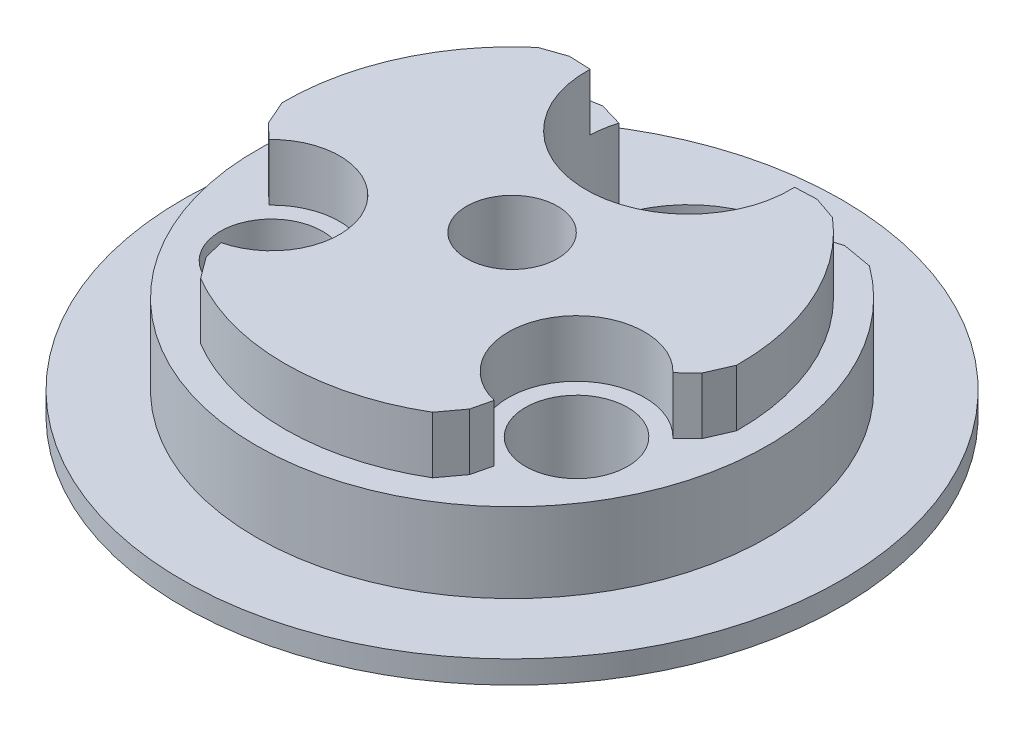
from build123d import *
from build123d.topology import SkipClean

# Parameters (mm, degrees)
BOSS_EXTRUDE1_DEPTH      = 7
BOSS_EXTRUDE3_DEPTH      = 5
BOSS_EXTRUDE3_DEPTH_BACK = 7
BOSS_EXTRUDE5_DEPTH      = 7
CUT_EXTRUDE1_START       = -5
CUT_EXTRUDE1_DEPTH       = 5
SKETCH5_R                = 4
CUT_EXTRUDE2_DEPTH       = 35.007352146
BOSS_EXTRUDE7_START      = 2
SKETCH6_R                = 29
SKETCH6_R_2              = 4.5
SKETCH6_R_3              = 4
BOSS_EXTRUDE7_DEPTH      = 2
CUT_EXTRUDE6_START       = -12
CUT_EXTRUDE6_DEPTH       = 12
BOSS_EXTRUDE8_DEPTH      = 7


with BuildPart() as part:
    # Sketch1 → Boss-Extrude1 (new body)
    with BuildSketch(Plane(origin=(0, 0, 0), x_dir=(1, 0, 0), z_dir=(0, 1, 0))):
        with BuildLine():
            ThreePointArc((21.960068583, -4.899529347), (22.364609801, -2.464594985), (22.5, 0))
            ThreePointArc((22.5, 0), (18.136022741, 13.316706768), (6.73691741, 21.467741935))
            ThreePointArc((6.73691741, 21.467741935), (8.415231925, 18.691217895), (9, 15.5))
            ThreePointArc((9, 15.5), (-3.191217895, 7.084768075), (-6.73691741, 21.467741935))
            ThreePointArc((-6.73691741, 21.467741935), (-19.485571585, 11.25), (-21.960068583, -4.899529347))
            ThreePointArc((-21.960068583, -4.899529347), (-11.979453563, 1.133413573), (-4.423393759, -7.75))
            ThreePointArc((-4.423393759, -7.75), (-7.731198081, -14.721291729), (-15.223151173, -16.568212588))
            ThreePointArc((-15.223151173, -16.568212588), (0, -22.5), (15.223151173, -16.568212588))
            ThreePointArc((15.223151173, -16.568212588), (5.629165125, -3.25), (21.960068583, -4.899529347))
        make_face()
    extrude(amount=BOSS_EXTRUDE1_DEPTH)

    # Sketch2 → Boss-Extrude3 (add, two sides: drawn at the far end of the back side and taken through both)
    with BuildSketch(Plane(origin=(0, 7, 0), x_dir=(1, 0, 0), z_dir=(0, 1, 0)).offset(-BOSS_EXTRUDE3_DEPTH_BACK)):
        with BuildLine():
            ThreePointArc((-11.306354333, -16.497465008), (0, -20), (11.306354333, -16.497465008))
            Line((11.306354333, -16.497465008), (12.364874046, -12.123732504))
            ThreePointArc((12.364874046, -12.123732504), (9.526279442, -5.5), (16.68189736, -4.646428786))
            Line((16.68189736, -4.646428786), (19.940400962, -1.542857572))
            ThreePointArc((19.940400962, -1.542857572), (17.320508076, 10), (8.634046629, 18.040322581))
            ThreePointArc((8.634046629, 18.040322581), (0, 6.5), (-8.634046629, 18.040322581))
            ThreePointArc((-8.634046629, 18.040322581), (-17.320508076, 10), (-19.940400962, -1.542857572))
            Line((-19.940400962, -1.542857572), (-16.68189736, -4.646428786))
            ThreePointArc((-16.68189736, -4.646428786), (-9.526279442, -5.5), (-12.364874046, -12.123732504))
            Line((-12.364874046, -12.123732504), (-11.306354333, -16.497465008))
        make_face()
    extrude(amount=BOSS_EXTRUDE3_DEPTH + BOSS_EXTRUDE3_DEPTH_BACK)

    # Sketch3 → Boss-Extrude5 (add)
    with SkipClean():  # the faces are left unmerged after this step: merging them gives an invalid solid
        with BuildSketch(Plane.XZ):
            with BuildLine():
                ThreePointArc((-11.306354333, 16.497465008), (-13.260856767, 16.748532198), (-15.223151173, 16.568212588))
                ThreePointArc((-15.223151173, 16.568212588), (-19.485571585, 11.25), (-21.960068583, 4.899529347))
                ThreePointArc((-21.960068583, 4.899529347), (-21.135082743, 3.109972737), (-19.940400962, 1.542857572))
                Line((-19.940400962, 1.542857572), (-16.68189736, 4.646428786))
                ThreePointArc((-16.68189736, 4.646428786), (-17.320508076, 10), (-12.364874046, 12.123732504))
                Line((-12.364874046, 12.123732504), (-11.306354333, 16.497465008))
            make_face()
            with BuildLine():
                ThreePointArc((-19.940400962, 1.542857572), (-5.629165125, 3.25), (-11.306354333, 16.497465008))
                Line((-11.306354333, 16.497465008), (-12.364874046, 12.123732504))
                ThreePointArc((-12.364874046, 12.123732504), (-9.886916789, 10.532684072), (-8.923393759, 7.75))
                ThreePointArc((-8.923393759, 7.75), (-11.7520569, 3.571886418), (-16.68189736, 4.646428786))
                Line((-16.68189736, 4.646428786), (-19.940400962, 1.542857572))
            make_face()
            with BuildLine():
                Line((16.68189736, 4.646428786), (19.940400962, 1.542857572))
                ThreePointArc((19.940400962, 1.542857572), (21.135082743, 3.109972737), (21.960068583, 4.899529347))
                ThreePointArc((21.960068583, 4.899529347), (19.485571585, 11.25), (15.223151173, 16.568212588))
                ThreePointArc((15.223151173, 16.568212588), (13.260856767, 16.748532198), (11.306354333, 16.497465008))
                Line((11.306354333, 16.497465008), (12.364874046, 12.123732504))
                ThreePointArc((12.364874046, 12.123732504), (16.206077831, 11.286476969), (17.923393759, 7.75))
                ThreePointArc((17.923393759, 7.75), (17.601507341, 6.078663141), (16.68189736, 4.646428786))
            make_face()
            with BuildLine():
                ThreePointArc((11.306354333, 16.497465008), (5.629165125, 3.25), (19.940400962, 1.542857572))
                Line((19.940400962, 1.542857572), (16.68189736, 4.646428786))
                ThreePointArc((16.68189736, 4.646428786), (9.526279442, 5.5), (12.364874046, 12.123732504))
                Line((12.364874046, 12.123732504), (11.306354333, 16.497465008))
            make_face()
        extrude(amount=-BOSS_EXTRUDE5_DEPTH)

    # Sketch4 → Cut-Extrude1 (cut)
    with SkipClean():  # the faces are left unmerged after this step: merging them gives an invalid solid
        with BuildSketch(Plane(origin=(0, 12, 0), x_dir=(1, 0, 0), z_dir=(0, 1, 0)).offset(CUT_EXTRUDE1_START)):
            with BuildLine():
                ThreePointArc((-17.768065227, -3.611905048), (-18.619546181, -10.75), (-12.012034142, -13.581643339))
                Line((-12.012034142, -13.581643339), (-12.364874046, -12.123732504))
                ThreePointArc((-12.364874046, -12.123732504), (-9.526279442, -5.5), (-16.68189736, -4.646428786))
                Line((-16.68189736, -4.646428786), (-17.768065227, -3.611905048))
            make_face()
            with BuildLine():
                Line((-12.364874046, -12.123732504), (-12.012034142, -13.581643339))
                ThreePointArc((-12.012034142, -13.581643339), (-8.708091133, -11.46024543), (-7.423393759, -7.75))
                ThreePointArc((-7.423393759, -7.75), (-11.194944613, -2.179181891), (-17.768065227, -3.611905048))
                Line((-17.768065227, -3.611905048), (-16.68189736, -4.646428786))
                ThreePointArc((-16.68189736, -4.646428786), (-9.526279442, -5.5), (-12.364874046, -12.123732504))
            make_face()
            with BuildLine():
                ThreePointArc((12.364874046, -12.123732504), (9.526279442, -5.5), (16.68189736, -4.646428786))
                Line((16.68189736, -4.646428786), (17.768065227, -3.611905048))
                ThreePointArc((17.768065227, -3.611905048), (8.227241336, -4.75), (12.012034142, -13.581643339))
                Line((12.012034142, -13.581643339), (12.364874046, -12.123732504))
            make_face()
            with BuildLine():
                Line((17.768065227, -3.611905048), (16.68189736, -4.646428786))
                ThreePointArc((16.68189736, -4.646428786), (9.526279442, -5.5), (12.364874046, -12.123732504))
                Line((12.364874046, -12.123732504), (12.012034142, -13.581643339))
                ThreePointArc((12.012034142, -13.581643339), (17.133639188, -12.465302626), (19.423393759, -7.75))
                ThreePointArc((19.423393759, -7.75), (18.994211868, -5.521550855), (17.768065227, -3.611905048))
            make_face()
        extrude(amount=CUT_EXTRUDE1_DEPTH, mode=Mode.SUBTRACT)

    # Sketch5 → Cut-Extrude2 (cut, through all)
    with SkipClean():  # the faces are left unmerged after this step: merging them gives an invalid solid
        with BuildSketch(Plane(origin=(0, 12, 0), x_dir=(1, 0, 0), z_dir=(0, 1, 0))):
            with Locations(Location((0, 0, 0), (0, 0, 270))):
                Circle(SKETCH5_R)
        extrude(amount=-CUT_EXTRUDE2_DEPTH, mode=Mode.SUBTRACT)

    # Sketch6 → Boss-Extrude7 (add)
    # profile 1 of 2: a face of its own
    with SkipClean():  # the faces are left unmerged after this step: merging them gives an invalid solid
        with BuildSketch(Plane.XZ.offset(BOSS_EXTRUDE7_START)):
            with Locations(Location((0, 0, 0), (0, 0, 270))):
                Circle(SKETCH6_R)
            with BuildLine():
                ThreePointArc((6.73691741, -21.467741935), (0, -24.5), (-6.73691741, -21.467741935))
                ThreePointArc((-6.73691741, -21.467741935), (0, 22.5), (6.73691741, -21.467741935))
            make_face(mode=Mode.SUBTRACT)
        # profile 2 of 2: a face of its own
        with BuildSketch(Plane.XZ.offset(BOSS_EXTRUDE7_START)):
            with BuildLine():
                ThreePointArc((6.73691741, -21.467741935), (0, 22.5), (-6.73691741, -21.467741935))
                ThreePointArc((-6.73691741, -21.467741935), (0, -6.5), (6.73691741, -21.467741935))
            make_face()
            with Locations(Location((-13.423393759, 7.75, 0), (0, 0, 270))):
                Circle(SKETCH6_R_2, mode=Mode.SUBTRACT)
            with Locations(Location((13.423393759, 7.75, 0), (0, 0, 270))):
                Circle(SKETCH6_R_2, mode=Mode.SUBTRACT)
            with Locations(Location((0, 0, 0), (0, 0, 90))):
                Circle(SKETCH6_R_3, mode=Mode.SUBTRACT)
        extrude(amount=-BOSS_EXTRUDE7_DEPTH)

    # Sketch7 → Cut-Extrude6 (cut)
    with SkipClean():  # the faces are left unmerged after this step: merging them gives an invalid solid
        with BuildSketch(Plane(origin=(0, 12, 0), x_dir=(1, 0, 0), z_dir=(0, 1, 0)).offset(CUT_EXTRUDE6_START)):
            with BuildLine():
                ThreePointArc((8.634046629, 18.040322581), (8.638200135, 18.038334137), (8.642353183, 18.036344737))
                Line((8.642353183, 18.036344737), (12.012034142, 19.025273606))
                ThreePointArc((12.012034142, 19.025273606), (9.453687585, 20.417585338), (6.73691741, 21.467741935))
                ThreePointArc((6.73691741, 21.467741935), (7.874225977, 19.858504935), (8.634046629, 18.040322581))
            make_face()
            with BuildLine():
                ThreePointArc((8.634046629, 18.040322581), (8.634914915, 18.037369585), (8.635782192, 18.034416292))
                Line((8.635782192, 18.034416292), (8.642353183, 18.036344737))
                ThreePointArc((8.642353183, 18.036344737), (8.638200135, 18.038334137), (8.634046629, 18.040322581))
            make_face()
            with BuildLine():
                Line((8.642353183, 18.036344737), (8.635782192, 18.034416292))
                ThreePointArc((8.635782192, 18.034416292), (8.880475096, 16.961903579), (8.992491714, 15.8675497))
                Line((8.992491714, 15.8675497), (12.012034142, 15.990967319))
                ThreePointArc((12.012034142, 15.990967319), (10.377707894, 17.09687629), (8.642353183, 18.036344737))
            make_face()
            with BuildLine():
                ThreePointArc((-6.73691741, 21.467741935), (-9.453687585, 20.417585338), (-12.012034142, 19.025273606))
                Line((-12.012034142, 19.025273606), (-8.642353183, 18.036344737))
                ThreePointArc((-8.642353183, 18.036344737), (-8.638200135, 18.038334137), (-8.634046629, 18.040322581))
                ThreePointArc((-8.634046629, 18.040322581), (-7.874225977, 19.858504935), (-6.73691741, 21.467741935))
            make_face()
            with BuildLine():
                Line((-12.012034142, 15.990967319), (-8.992491714, 15.8675497))
                ThreePointArc((-8.992491714, 15.8675497), (-8.880475096, 16.961903579), (-8.635782192, 18.034416292))
                Line((-8.635782192, 18.034416292), (-8.642353183, 18.036344737))
                ThreePointArc((-8.642353183, 18.036344737), (-10.377707894, 17.09687629), (-12.012034142, 15.990967319))
            make_face()
            with BuildLine():
                Line((-8.642353183, 18.036344737), (-8.635782192, 18.034416292))
                ThreePointArc((-8.635782192, 18.034416292), (-8.634914915, 18.037369585), (-8.634046629, 18.040322581))
                ThreePointArc((-8.634046629, 18.040322581), (-8.638200135, 18.038334137), (-8.642353183, 18.036344737))
            make_face()
        extrude(amount=CUT_EXTRUDE6_DEPTH, mode=Mode.SUBTRACT)

    # Sketch8 → Boss-Extrude8 (add)
    with SkipClean():  # the faces are left unmerged after this step: merging them gives an invalid solid
        with BuildSketch(Plane(origin=(0, 0, 0), x_dir=(1, 0, 0), z_dir=(0, 1, 0))):
            with BuildLine():
                Line((-12.012034142, 15.990967319), (-8.992491714, 15.8675497))
                ThreePointArc((-8.992491714, 15.8675497), (-8.879974605, 16.96494062), (-8.634046629, 18.040322581))
                ThreePointArc((-8.634046629, 18.040322581), (-10.37377111, 17.099265275), (-12.012034142, 15.990967319))
            make_face()
            with BuildLine():
                Line((8.992491714, 15.8675497), (12.012034142, 15.990967319))
                ThreePointArc((12.012034142, 15.990967319), (10.37377111, 17.099265275), (8.634046629, 18.040322581))
                ThreePointArc((8.634046629, 18.040322581), (8.879974605, 16.96494062), (8.992491714, 15.8675497))
            make_face()
        extrude(amount=BOSS_EXTRUDE8_DEPTH)

    # Fillet1
    # the kernel refuses this chamfer: 3 mm, written as the material it takes off along each edge
    with BuildSketch(Plane(origin=(12.012034142, 7, -15.990967319), x_dir=(0.7995517704478904, 0, 0.6005971747965888), z_dir=(0, 1, 0))) as fillet1_piece_1:
        with BuildLine():
            Line((1.213528757, -0.036857141), (-0.866764272, -0.70825745))
            Line((-0.866764272, -0.70825745), (0, 0))
            ThreePointArc((0, 0), (0.66349858, -0.011012552), (1.213528757, -0.036857141))
        make_face()
    extrude(amount=8.319320921, mode=Mode.SUBTRACT)
    with BuildSketch(Plane(origin=(12.012034142, 0, -19.025273606), x_dir=(0.8437207298406628, 0, 0.5367823861092493), z_dir=(0, 1, 0))) as fillet1_piece_2:
        with BuildLine():
            Line((1.518754527, -0.046065538), (-0.931353915, -1.064652801))
            Line((-0.931353915, -1.064652801), (0, 0))
            ThreePointArc((0, 0), (0.814389338, -0.011931871), (1.518754527, -0.046065538))
        make_face()
    extrude(amount=11.073901279, mode=Mode.SUBTRACT)
    with BuildSketch(Plane(origin=(-12.012034142, 7, -15.990967319), x_dir=(-0.799551770447954, 0, 0.6005971747965038), z_dir=(0, 1, 0))) as fillet1_piece_3:
        with BuildLine():
            Line((1.213528757, 0.036857141), (-0.866764272, 0.70825745))
            Line((-0.866764272, 0.70825745), (0, 0))
            ThreePointArc((0, 0), (0.66349858, 0.011012552), (1.213528757, 0.036857141))
        make_face()
    extrude(amount=8.319320921, mode=Mode.SUBTRACT)
    with BuildSketch(Plane(origin=(-12.012034142, 0, -19.025273606), x_dir=(-0.843720729840673, 0, 0.5367823861092332), z_dir=(0, 1, 0))) as fillet1_piece_4:
        with BuildLine():
            Line((1.518754527, 0.046065538), (-0.931353915, 1.064652801))
            Line((-0.931353915, 1.064652801), (0, 0))
            ThreePointArc((0, 0), (0.814389338, 0.011931871), (1.518754527, 0.046065538))
        make_face()
    extrude(amount=11.073901279, mode=Mode.SUBTRACT)
    with BuildSketch(Plane(origin=(19.940400962, 7, 1.542857572), x_dir=(-0.6992361724703339, 0, 0.7148907434769579), z_dir=(0, 1, 0))) as fillet1_piece_5:
        with BuildLine():
            Line((1.204235817, -0.042668697), (-0.974123895, -0.87139156))
            ThreePointArc((-0.974123895, -0.87139156), (-0.535859817, -0.465123865), (0, 0))
            Line((0, 0), (1.204235817, -0.042668697))
        make_face()
    extrude(amount=8.549220137, mode=Mode.SUBTRACT)
    with BuildSketch(Plane(origin=(11.306354333, 7, 16.497465008), x_dir=(-0.826230478481032, 0, 0.5633322256262328), z_dir=(0, 1, 0)), Plane(origin=(-11.306354333, 15.549220137, 16.497465008), x_dir=(0.8262304784811115, 0, 0.5633322256261161), z_dir=(0, -1, 0))) as fillet1_piece_6:
        with BuildLine():
            Line((1.306397829, -0.039564186), (-0.893955271, -0.807990405))
            Line((-0.893955271, -0.807990405), (0, 0))
            ThreePointArc((0, 0), (0.70948401, -0.01088084), (1.306397829, -0.039564186))
        make_face()
    extrude(amount=8.549220137, mode=Mode.SUBTRACT)
    with BuildSketch(Plane(origin=(-19.940400962, 7, 1.542857572), x_dir=(0.6992361724705505, 0, 0.7148907434767461), z_dir=(0, 1, 0))) as fillet1_piece_7:
        with BuildLine():
            Line((1.204235817, 0.042668697), (-0.974123895, 0.87139156))
            ThreePointArc((-0.974123895, 0.87139156), (-0.535859817, 0.465123865), (0, 0))
            Line((0, 0), (1.204235817, 0.042668697))
        make_face()
    extrude(amount=8.549220137, mode=Mode.SUBTRACT)


solid = part.part
